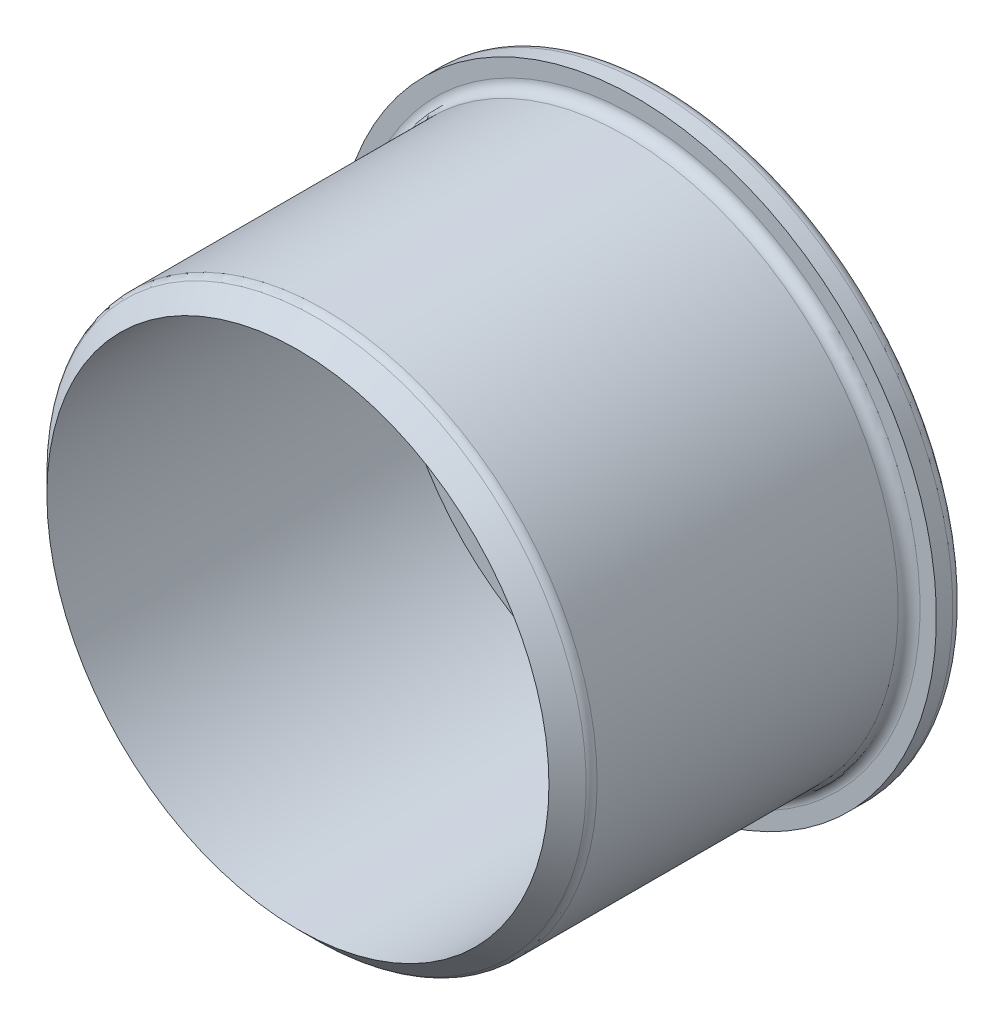
from build123d import *

# Parameters (mm, degrees)
SKETCH_1_R          = 25
EXTRUDE_1_DEPTH     = 32
SKETCH_2_R          = 27.5
EXTRUDE_2_DEPTH     = 2.5
SKETCH_3_R          = 23
CUT_EXTRUDE_1_DEPTH = 32.5
CHAMFER_1_SIZE      = 3
FILLET_1_R          = 1
FILLET_2_R          = 1
FILLET_3_R          = 1
SKETCH_4_R          = 1.6
CUT_EXTRUDE_2_DEPTH = 32.5


with BuildPart() as part:
    # Эскиз1 → Бобышка-Вытянуть1 (new body)
    with BuildSketch(Plane.XY):
        Circle(SKETCH_1_R)
    extrude(amount=EXTRUDE_1_DEPTH)

    # Эскиз2 → Бобышка-Вытянуть2 (add)
    with BuildSketch(Plane(origin=(0, 0, 0), x_dir=(-1, 0, 0), z_dir=(0, 0, -1))):
        Circle(SKETCH_2_R)
    extrude(amount=EXTRUDE_2_DEPTH)

    # Эскиз3 → Вырез-Вытянуть1 (cut)
    with BuildSketch(Plane.XY.offset(32)):
        Circle(SKETCH_3_R)
    extrude(amount=-CUT_EXTRUDE_1_DEPTH, mode=Mode.SUBTRACT)

    # Фаска1
    # the kernel refuses this chamfer: 3 mm, written as the material it takes off along each edge
    with BuildSketch(Plane(origin=(0, 0, 32), x_dir=(1, 0, 0), z_dir=(0, -1, 0))) as chamfer_1_piece_1:
        Polygon((25, -CHAMFER_1_SIZE), (25 - CHAMFER_1_SIZE, 0), (25, 0), align=None)
    revolve(axis=Axis((0, 0, 32), (0, 0, 1)), mode=Mode.SUBTRACT)

    # Скругление1
    fillet_1_edges = [part.edges().sort_by_distance(p)[0] for p in [
        (-25, 0, 29),
    ]]
    fillet(fillet_1_edges, radius=FILLET_1_R)

    # Скругление2
    fillet_2_edges = [part.edges().sort_by_distance(p)[0] for p in [
        (-25, 0, 0),
    ]]
    fillet(fillet_2_edges, radius=FILLET_2_R)

    # Скругление3
    fillet_3_edges = [part.edges().sort_by_distance(p)[0] for p in [
        (27.5, 0, -2.5),
    ]]
    fillet(fillet_3_edges, radius=FILLET_3_R)

    # Эскиз4 → Вырез-Вытянуть2 (cut)
    with BuildSketch(Plane(origin=(0, 0, -2.5), x_dir=(-1, 0, 0), z_dir=(0, 0, -1))):
        Circle(SKETCH_4_R)
    extrude(amount=-CUT_EXTRUDE_2_DEPTH, mode=Mode.SUBTRACT)


solid = part.part
